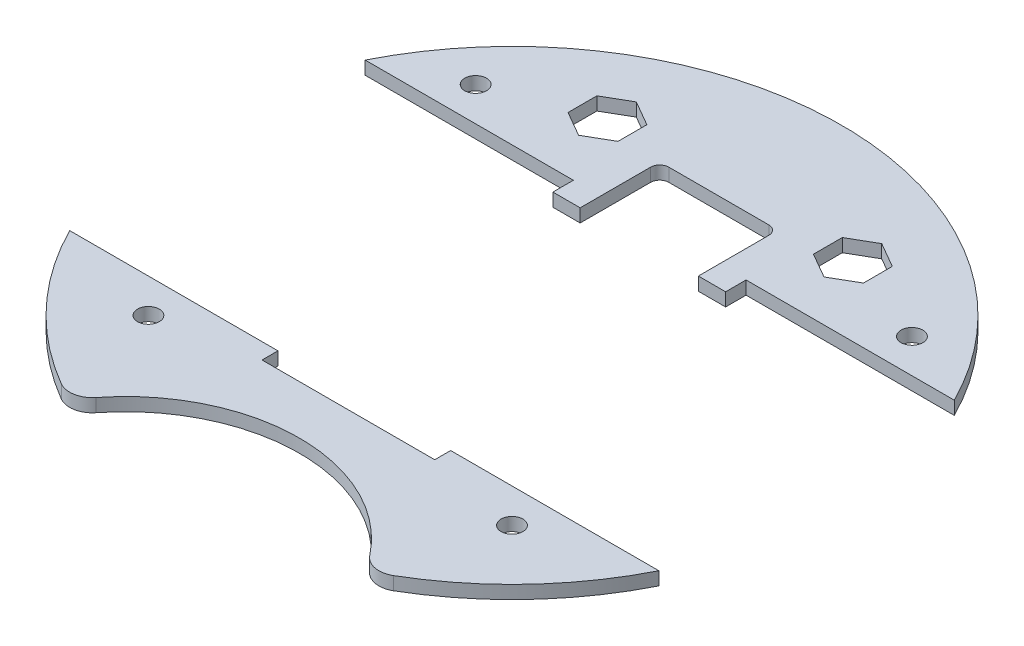
from build123d import *

# Parameters (mm, degrees)
BOSS_EXTRUDE1_DEPTH  = 2.9
SOLENOID_PLACEMENT_W = 38
SOLENOID_PLACEMENT_H = 64
CUT_EXTRUDE1_DEPTH   = 103.571487266
CUT_EXTRUDE5_DEPTH   = 103.571487266
SKETCH6_R            = 2.4
CUT_EXTRUDE6_DEPTH   = 103.571487266
CUT_EXTRUDE3_DEPTH   = 103.571487266
CUT_EXTRUDE7_DEPTH   = 98.286484159


with BuildPart() as part:
    # Sketch1 → Boss-Extrude1 (new body)
    with BuildSketch(Plane(origin=(0, 0, 0), x_dir=(1, 0, 0), z_dir=(0, 1, 0))):
        with BuildLine():
            ThreePointArc((36.543377003, -62.616544118), (0, 72.5), (-36.543377003, -62.616544118))
            ThreePointArc((-36.543377003, -62.616544118), (-33.085954668, -63.20954405), (-30.089832649, -61.38507948))
            ThreePointArc((-30.089832649, -61.38507948), (0, -46.75), (30.089832649, -61.38507948))
            ThreePointArc((30.089832649, -61.38507948), (33.085954668, -63.20954405), (36.543377003, -62.616544118))
        make_face()
    extrude(amount=BOSS_EXTRUDE1_DEPTH)

    # solenoid placement → Cut-Extrude1 (cut, through all)
    with BuildSketch(Plane(origin=(0, 2.9, 0), x_dir=(1, 0, 0), z_dir=(0, 1, 0))):
        with Locations((0, -4)):
            Rectangle(SOLENOID_PLACEMENT_W, SOLENOID_PLACEMENT_H)
    extrude(amount=-CUT_EXTRUDE1_DEPTH, mode=Mode.SUBTRACT)

    # Sketch5 → Cut-Extrude5 (cut, through all)
    with BuildSketch(Plane(origin=(0, 2.9, 0), x_dir=(1, 0, 0), z_dir=(0, 1, 0))):
        Polygon((-21.5, 51.175426481), (-27, 54.350852961), (-32.5, 51.175426481), (-32.5, 44.824573519), (-27, 41.649147039), (-21.5, 44.824573519), align=None)
        Polygon((21.5, 51.175426481), (21.5, 44.824573519), (27, 41.649147039), (32.5, 44.824573519), (32.5, 51.175426481), (27, 54.350852961), align=None)
    extrude(amount=-CUT_EXTRUDE5_DEPTH, mode=Mode.SUBTRACT)

    # Sketch6 → Cut-Extrude6 (cut, through all)
    with BuildSketch(Plane(origin=(0, 2.9, 0), x_dir=(1, 0, 0), z_dir=(0, 1, 0))):
        with Locations((40, -40)):
            Circle(SKETCH6_R)
        with Locations((-40, -40)):
            Circle(SKETCH6_R)
        with Locations((48, 40)):
            Circle(SKETCH6_R)
        with Locations((-48, 40)):
            Circle(SKETCH6_R)
    extrude(amount=-CUT_EXTRUDE6_DEPTH, mode=Mode.SUBTRACT)

    # Sketch3 → Cut-Extrude3 (cut, through all)
    with BuildSketch(Plane(origin=(0, 2.9, 0), x_dir=(1, 0, 0), z_dir=(0, 1, 0))):
        Polygon((-19, 28), (-19, 32.5), (-72.5, 32.5), (-72.5, -32.5), (72.5, -32.5), (72.5, 32.5), (19, 32.5), (19, 28), align=None)
    extrude(amount=-CUT_EXTRUDE3_DEPTH, mode=Mode.SUBTRACT)


with BuildPart() as cut_extrude3_piece_1:
    # of the separate pieces the step leaves, piece 1, a body of its own (cut_extrude3_pieces)
    add(part.part.solids().sort_by_distance((64.807406984, 0, -32.5))[0])

    # Sketch7 → Cut-Extrude7 (cut, through all)
    with BuildSketch(Plane(origin=(0, 2.9, 0), x_dir=(1, 0, 0), z_dir=(0, 1, 0))):
        with BuildLine():
            Line((13, 28), (13, 43.5))
            ThreePointArc((13, 43.5), (12.414213562, 44.914213562), (11, 45.5))
            Line((11, 45.5), (-11, 45.5))
            ThreePointArc((-11, 45.5), (-12.414213562, 44.914213562), (-13, 43.5))
            Line((-13, 43.5), (-13, 28))
            Line((-13, 28), (13, 28))
        make_face()
    extrude(amount=-CUT_EXTRUDE7_DEPTH, mode=Mode.SUBTRACT)


with BuildPart() as cut_extrude3_piece_2:
    # of the separate pieces the step leaves, piece 2, a body of its own (cut_extrude3_pieces)
    add(part.part.solids().sort_by_distance((-36.543377003, 0, 62.616544118))[0])


solid = Compound([cut_extrude3_piece_1.part, cut_extrude3_piece_2.part])
